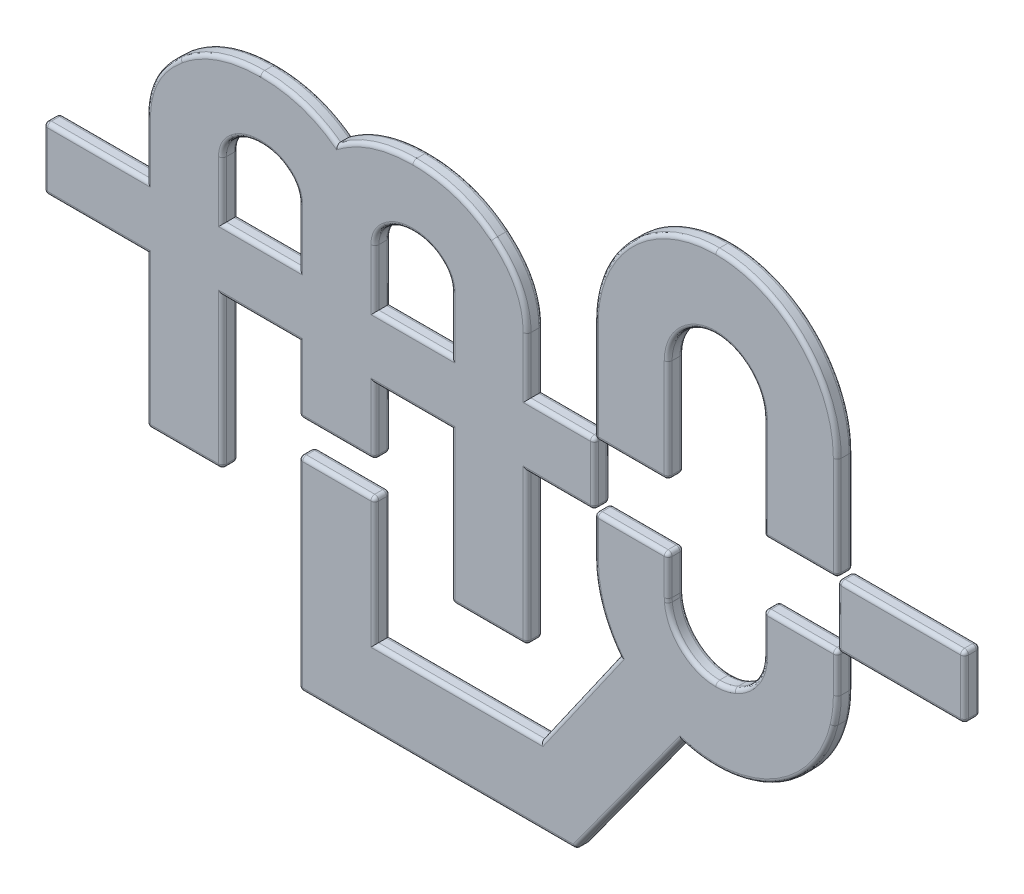
from build123d import *

# Parameters (mm, degrees)
RESSALTO_EXTRUS_O1_DEPTH   = 1
RESSALTO_EXTRUS_O1_2_DEPTH = 1
RESSALTO_EXTRUS_O1_3_DEPTH = 1
ESBO_O1_W                  = 8.061747269
ESBO_O1_H                  = 3.978059691
RESSALTO_EXTRUS_O1_4_DEPTH = 1
FILETE1_R                  = 0.25
FILETE2_R                  = 0.25
FILETE3_R                  = 0.25
FILETE4_R                  = 0.25


with BuildPart() as part:
    # Esboço1 → Ressalto-extrusão1 (new body)
    with BuildSketch(Plane.XY):
        with BuildLine():
            Line((39.102792411, -22.842920896), (39.102792411, -29.360432264))
            Line((39.102792411, -29.360432264), (43.78038713, -29.360432264))
            Line((43.78038713, -29.360432264), (43.78038713, -22.842920896))
            add(Edge.make_bspline(
                [(43.78038713, -22.842920896), (43.78038713, -21.208943181), (45.163603336, -19.825726975), (48.436875604, -19.825726975), (49.817449502, -21.208943181), (49.817449502, -22.842920896)],
                knots=[4, 4, 4, 4, 5, 5, 6.00321442, 6.00321442, 6.00321442, 6.00321442], degree=3))
            Line((49.817449502, -22.842920896), (49.817449502, -29.360432264))
            Line((49.817449502, -29.360432264), (54.49504422, -29.360432264))
            Line((54.49504422, -29.360432264), (54.49504422, -22.842920896))
            add(Edge.make_bspline(
                [(54.49504422, -22.842920896), (54.49504422, -18.611425165), (51.03439362, -15.145489949), (42.568759851, -15.145489949), (39.102792411, -18.611425165), (39.102792411, -22.842920896)],
                knots=[9, 9, 9, 9, 10, 10, 10.998129021, 10.998129021, 10.998129021, 10.998129021], degree=3))
        make_face()
    extrude(amount=RESSALTO_EXTRUS_O1_DEPTH)

    # Filete2
    filete2_edges = [part.edges().sort_by_distance(p)[0] for p in [
        (54.49504422, -26.10167658, 0),
        (46.799340909, -15.145490141, 0),
        (46.799340909, -15.145490141, 0),
        (39.102792411, -26.10167658, 0),
        (41.44158977, -29.360432264, 0),
        (43.78038713, -26.10167658, 0),
        (46.7990481, -19.825727329, 0),
        (46.7990481, -19.825727329, 0),
        (49.817449502, -26.10167658, 0),
        (52.156246861, -29.360432264, 0),
        (54.49504422, -26.10167658, 1),
        (46.799340909, -15.145490141, 1),
        (39.102792411, -26.10167658, 1),
        (41.44158977, -29.360432264, 1),
        (43.78038713, -26.10167658, 1),
        (46.7990481, -19.825727329, 1),
        (46.7990481, -19.825727329, 1),
        (49.817449502, -26.10167658, 1),
        (52.156246861, -29.360432264, 1),
        (54.49504422, -29.360432264, 0.5),
        (49.817449502, -29.360432264, 0.5),
        (43.78038713, -29.360432264, 0.5),
        (39.102792411, -29.360432264, 0.5),
        (46.799340909, -15.145490141, 1),
    ]]
    fillet(filete2_edges, radius=FILETE2_R)


with BuildPart() as body_2:
    # Esboço1 → Ressalto-extrus_o1 2 (new body)
    with BuildSketch(Plane.XY):
        with BuildLine():
            Line((39.102792411, -33.338491955), (39.102792411, -29.360432264))
            Line((39.102792411, -29.360432264), (34.839621204, -29.360432264))
            Line((34.839621204, -29.360432264), (34.839621204, -25.767762916))
            add(Edge.make_bspline(
                [(34.839621204, -25.767762916), (34.839621204, -24.123215968), (34.134833782, -22.724145912), (32.722552184, -21.565300354)],
                knots=[22, 22, 22, 22, 23, 23, 23, 23], degree=3))
            add(Edge.make_bspline(
                [(32.722552184, -21.565300354), (31.312945118, -20.406454797), (29.605014993, -19.825726975), (25.751047126, -19.825726975), (24.14078574, -20.332534609), (22.776065693, -21.343572015)],
                knots=[0, 0, 0, 0, 1, 1, 1.926144233, 1.926144233, 1.926144233, 1.926144233], degree=3))
            add(Edge.make_bspline(
                [(22.776065693, -21.343572015), (21.424492741, -20.332534609), (19.819580418, -19.825726975), (15.965548105, -19.825726975), (14.255007894, -20.409097105), (12.837473903, -21.57322728)],
                knots=[2, 2, 2, 2, 3, 3, 4.079780204, 4.079780204, 4.079780204, 4.079780204], degree=3))
            add(Edge.make_bspline(
                [(12.837473903, -21.57322728), (11.433151453, -22.726788221), (10.730941894, -24.123215968), (10.730941894, -25.767762916)],
                knots=[4, 4, 4, 4, 5, 5, 5, 5], degree=3))
            Line((10.730941894, -25.767762916), (10.730941894, -29.360432264))
            Line((10.730941894, -29.360432264), (4.21082044, -29.360432264))
            Line((4.21082044, -29.360432264), (4.21082044, -33.338491955))
            Line((4.21082044, -33.338491955), (10.730941894, -33.338491955))
            Line((10.730941894, -33.338491955), (10.730941894, -42.873197244))
            Line((10.730941894, -42.873197244), (15.540555361, -42.873197244))
            Line((15.540555361, -42.873197244), (15.540555361, -33.338491955))
            Line((15.540555361, -33.338491955), (20.370616286, -33.338927447))
            Line((20.370616286, -33.338927447), (20.371242848, -37.527742975))
            Line((20.371242848, -37.527742975), (25.19932025, -37.527742975))
            Line((25.19932025, -37.527742975), (25.200193332, -33.338927447))
            Line((25.200193332, -33.338927447), (30.03003996, -33.338491955))
            Line((30.03003996, -33.338491955), (30.03003996, -42.873197244))
            Line((30.03003996, -42.873197244), (34.839621204, -42.873197244))
            Line((34.839621204, -42.873197244), (34.839621204, -33.338491955))
            Line((34.839621204, -33.338491955), (39.102792411, -33.338491955))
        make_face()
        with BuildLine():
            Line((20.371242848, -25.767762916), (20.370616286, -29.361469958))
            Line((20.370616286, -29.361469958), (15.540555361, -29.360432264))
            Line((15.540555361, -29.360432264), (15.540555361, -25.767762916))
            add(Edge.make_bspline(
                [(15.540555361, -25.767762916), (15.540555361, -25.221320657), (15.775495242, -24.756725511), (16.245375005, -24.371335168)],
                knots=[8, 8, 8, 8, 9, 9, 9, 9], degree=3))
            add(Edge.make_bspline(
                [(16.245375005, -24.371335168), (16.717897077, -23.985944826), (17.290697973, -23.790607347), (18.629059383, -23.790607347), (19.199217971, -23.983302518), (19.674382351, -24.363408243)],
                knots=[9, 9, 9, 9, 10, 10, 10.980450124, 10.980450124, 10.980450124, 10.980450124], degree=3))
            add(Edge.make_bspline(
                [(19.674382351, -24.363408243), (20.138977498, -24.754083202), (20.371242848, -25.221320657), (20.371242848, -25.767762916)],
                knots=[11, 11, 11, 11, 12, 12, 12, 12], degree=3))
        make_face(mode=Mode.SUBTRACT)
        with BuildLine():
            Line((30.03003996, -29.360432264), (25.200193332, -29.361469958))
            Line((25.200193332, -29.361469958), (25.19932025, -25.767762916))
            add(Edge.make_bspline(
                [(25.19932025, -25.767762916), (25.19932025, -25.221320657), (25.434260131, -24.756725511), (25.906782203, -24.371335168)],
                knots=[15, 15, 15, 15, 16, 16, 16, 16], degree=3))
            add(Edge.make_bspline(
                [(25.906782203, -24.371335168), (26.376629743, -23.985944826), (26.941568161, -23.790607347), (28.279897348, -23.790607347), (28.850088159, -23.983302518), (29.314683305, -24.363408243)],
                knots=[16, 16, 16, 16, 17, 17, 18.019891061, 18.019891061, 18.019891061, 18.019891061], degree=3))
            add(Edge.make_bspline(
                [(29.314683305, -24.363408243), (29.79245777, -24.754083202), (30.03003996, -25.221320657), (30.03003996, -25.767762916)],
                knots=[18, 18, 18, 18, 19, 19, 19, 19], degree=3))
            Line((30.03003996, -25.767762916), (30.03003996, -29.360432264))
        make_face(mode=Mode.SUBTRACT)
    extrude(amount=RESSALTO_EXTRUS_O1_2_DEPTH)

    # Filete1
    filete1_edges = [body_2.edges().sort_by_distance(p)[0] for p in [
        (15.727817735, -24.987648089, 0),
        (17.95824139, -23.790617046, 0),
        (17.95824139, -23.790617046, 0),
        (20.186268852, -24.985863664, 0),
        (20.370929567, -27.564616437, 0),
        (17.955585823, -29.360951111, 0),
        (15.540555361, -27.56409759, 0),
        (25.387268762, -24.987030603, 0),
        (27.609078559, -23.790610776, 0),
        (27.609078559, -23.790610776, 0),
        (29.838702371, -24.982495141, 0),
        (30.03003996, -27.56409759, 0),
        (27.615116646, -29.360951111, 0),
        (25.199756791, -27.564616437, 0),
        (17.767887254, -19.827661091, 0),
        (11.288604185, -23.425672149, 0),
        (10.730941894, -27.56409759, 0),
        (7.470881167, -29.360432264, 0),
        (4.21082044, -31.34946211, 0),
        (7.470881167, -33.338491955, 0),
        (10.730941894, -38.105844599, 0),
        (13.135748627, -42.873197244, 0),
        (15.540555361, -38.105844599, 0),
        (17.955585823, -33.338709701, 0),
        (20.370929567, -35.433335211, 0),
        (22.785281549, -37.527742975, 0),
        (25.199756791, -35.433335211, 0),
        (27.615116646, -33.338709701, 0),
        (30.03003996, -38.105844599, 0),
        (32.434830582, -42.873197244, 0),
        (34.839621204, -38.105844599, 0),
        (36.971206808, -33.338491955, 0),
        (39.102792411, -31.34946211, 0),
        (36.971206808, -29.360432264, 0),
        (34.839621204, -27.56409759, 0),
        (34.277925454, -23.42049707, 0),
        (27.788041731, -19.827376934, 0),
        (27.788041731, -19.827376934, 0),
        (17.767887254, -19.827661091, 0),
        (15.727817735, -24.987648089, 1),
        (17.95824139, -23.790617046, 1),
        (17.95824139, -23.790617046, 1),
        (20.186268852, -24.985863664, 1),
        (20.370929567, -27.564616437, 1),
        (17.955585823, -29.360951111, 1),
        (15.540555361, -27.56409759, 1),
        (25.387268762, -24.987030603, 1),
        (27.609078559, -23.790610776, 1),
        (27.609078559, -23.790610776, 1),
        (29.838702371, -24.982495141, 1),
        (30.03003996, -27.56409759, 1),
        (27.615116646, -29.360951111, 1),
        (25.199756791, -27.564616437, 1),
        (17.767887254, -19.827661091, 1),
        (10.730941894, -27.56409759, 1),
        (7.470881167, -29.360432264, 1),
        (4.21082044, -31.34946211, 1),
        (7.470881167, -33.338491955, 1),
        (10.730941894, -38.105844599, 1),
        (13.135748627, -42.873197244, 1),
        (15.540555361, -38.105844599, 1),
        (17.955585823, -33.338709701, 1),
        (20.370929567, -35.433335211, 1),
        (22.785281549, -37.527742975, 1),
        (25.199756791, -35.433335211, 1),
        (27.615116646, -33.338709701, 1),
        (30.03003996, -38.105844599, 1),
        (32.434830582, -42.873197244, 1),
        (34.839621204, -38.105844599, 1),
        (36.971206808, -33.338491955, 1),
        (39.102792411, -31.34946211, 1),
        (36.971206808, -29.360432264, 1),
        (34.839621204, -27.56409759, 1),
        (34.277925454, -23.42049707, 1),
        (27.788041731, -19.827376934, 1),
        (27.788041731, -19.827376934, 1),
        (17.767887254, -19.827661091, 1),
        (25.906782203, -24.371335168, 0.5),
        (39.102792411, -29.360432264, 0.5),
        (39.102792411, -33.338491955, 0.5),
        (34.839621204, -42.873197244, 0.5),
        (30.03003996, -42.873197244, 0.5),
        (25.19932025, -37.527742975, 0.5),
        (20.371242848, -37.527742975, 0.5),
        (15.540555361, -42.873197244, 0.5),
        (10.730941894, -42.873197244, 0.5),
        (4.21082044, -33.338491955, 0.5),
        (4.21082044, -29.360432264, 0.5),
        (11.288604185, -23.425672149, 1),
    ]]
    fillet(filete1_edges, radius=FILETE1_R)


with BuildPart() as body_3:
    # Esboço1 → Ressalto-extrus_o1 3 (new body)
    with BuildSketch(Plane.XY):
        with BuildLine():
            Line((43.78038713, -33.338491955), (39.102792411, -33.338491955))
            Line((39.102792411, -33.338491955), (39.102792411, -35.840951316))
            add(Edge.make_bspline(
                [(39.102792411, -35.840951316), (39.102792411, -37.588483844), (39.694089466, -39.211892325), (40.689273022, -40.508009024)],
                knots=[8, 8, 8, 8, 9, 9, 9, 9], degree=3))
            Line((40.689273022, -40.508009024), (35.716029776, -47.61417514))
            Line((35.716029776, -47.61417514), (25.188751016, -47.61417514))
            Line((25.188751016, -47.61417514), (25.188751016, -39.594640358))
            Line((25.188751016, -39.594640358), (20.371242848, -39.594640358))
            Line((20.371242848, -39.594640358), (20.371242848, -52.500318879))
            Line((20.371242848, -52.500318879), (37.893807441, -52.502961188))
            Line((37.893807441, -52.502961188), (44.622477916, -43.221627492))
            add(Edge.make_bspline(
                [(44.622477916, -43.221627492), (45.314053796, -43.427534205), (46.042621993, -43.538414486), (50.432527332, -43.538414486), (53.499860665, -40.988425798), (54.291779816, -37.585841535)],
                knots=[10, 10, 10, 10, 11, 11, 15.81451131, 15.81451131, 15.81451131, 15.81451131], degree=3))
            add(Edge.make_bspline(
                [(54.291779816, -37.585841535), (54.426408649, -37.023545426), (54.49504422, -36.440175296), (54.49504422, -35.840951316)],
                knots=[12, 12, 12, 12, 13, 13, 13, 13], degree=3))
            Line((54.49504422, -35.840951316), (54.49504422, -33.338491955))
            Line((54.49504422, -33.338491955), (49.817449502, -33.338491955))
            Line((49.817449502, -33.338491955), (49.817449502, -35.840951316))
            add(Edge.make_bspline(
                [(49.242006297, -37.585841535), (49.603615864, -37.092180997), (49.817449502, -36.487704623), (49.817449502, -35.840951316)],
                knots=[0, 0, 0, 0, 1, 1, 1, 1], degree=3))
            add(Edge.make_bspline(
                [(47.964353533, -38.615310653), (48.476478007, -38.396224622), (48.917324601, -38.034582832), (49.242006297, -37.585841535)],
                knots=[1, 1, 1, 1, 2, 2, 2, 2], degree=3))
            add(Edge.make_bspline(
                [(47.964353533, -38.615310653), (47.605354051, -38.773720262), (47.209394476, -38.860819768), (45.240165832, -38.860819768), (43.915015963, -37.609590087), (43.790956363, -36.075891198)],
                knots=[2, 2, 2, 2, 3, 3, 6.782220831, 6.782220831, 6.782220831, 6.782220831], degree=3))
            add(Edge.make_bspline(
                [(43.78038713, -35.840951316), (43.78038713, -35.917513812), (43.783029438, -35.999360925), (43.790956363, -36.075891198)],
                knots=[4, 4, 4, 4, 5, 5, 5, 5], degree=3))
            Line((43.78038713, -35.840951316), (43.78038713, -33.338491955))
        make_face()
    extrude(amount=RESSALTO_EXTRUS_O1_3_DEPTH)

    # Filete4
    filete4_edges = [body_3.edges().sort_by_distance(p)[0] for p in [
        (39.102792411, -34.589721635, 0),
        (39.509780744, -38.305719132, 0),
        (38.202651399, -44.061092082, 0),
        (30.452390396, -47.61417514, 0),
        (25.188751016, -43.604407749, 0),
        (22.779996932, -39.594640358, 0),
        (20.371242848, -46.047479619, 0),
        (29.132525144, -52.501640033, 0),
        (41.258142679, -47.86229434, 0),
        (50.669413402, -42.487749107, 0),
        (50.669413402, -42.487749107, 0),
        (54.44480927, -36.719403815, 0),
        (54.49504422, -34.589721635, 0),
        (52.156246861, -33.338491955, 0),
        (49.817449502, -34.589721635, 0),
        (49.669177826, -36.759278337, 0),
        (48.672839124, -38.187208144, 0),
        (45.236192412, -38.410349874, 0),
        (45.236192412, -38.410349874, 0),
        (43.782704422, -35.958559696, 0),
        (43.78038713, -34.589721635, 0),
        (41.44158977, -33.338491955, 0),
        (39.102792411, -34.589721635, 1),
        (39.509780744, -38.305719132, 1),
        (38.202651399, -44.061092082, 1),
        (30.452390396, -47.61417514, 1),
        (25.188751016, -43.604407749, 1),
        (22.779996932, -39.594640358, 1),
        (20.371242848, -46.047479619, 1),
        (29.132525144, -52.501640033, 1),
        (41.258142679, -47.86229434, 1),
        (50.669413402, -42.487749107, 1),
        (50.669413402, -42.487749107, 1),
        (54.44480927, -36.719403815, 1),
        (54.49504422, -34.589721635, 1),
        (49.817449502, -34.589721635, 1),
        (49.669177826, -36.759278337, 1),
        (48.672839124, -38.187208144, 1),
        (45.236192412, -38.410349874, 1),
        (45.236192412, -38.410349874, 1),
        (43.782704422, -35.958559696, 1),
        (43.78038713, -34.589721635, 1),
        (41.44158977, -33.338491955, 1),
        (39.102792411, -33.338491955, 0.5),
        (43.78038713, -33.338491955, 0.5),
        (43.790956363, -36.075891198, 0.5),
        (47.964353533, -38.615310653, 0.5),
        (49.242006297, -37.585841535, 0.5),
        (49.817449502, -33.338491955, 0.5),
        (54.49504422, -33.338491955, 0.5),
        (37.893807441, -52.502961188, 0.5),
        (20.371242848, -52.500318879, 0.5),
        (20.371242848, -39.594640358, 0.5),
        (25.188751016, -39.594640358, 0.5),
        (52.156246861, -33.338491955, 1),
    ]]
    fillet(filete4_edges, radius=FILETE4_R)


with BuildPart() as body_4:
    # Esboço1 → Ressalto-extrus_o1 4 (new body)
    with BuildSketch(Plane.XY):
        with Locations((58.525917855, -31.34946211)):
            Rectangle(ESBO_O1_W, ESBO_O1_H)
    extrude(amount=RESSALTO_EXTRUS_O1_4_DEPTH)

    # Filete3
    filete3_edges = [body_4.edges().sort_by_distance(p)[0] for p in [
        (54.49504422, -31.34946211, 0),
        (58.525917855, -33.338491955, 0),
        (62.556791489, -31.34946211, 0),
        (58.525917855, -29.360432264, 0),
        (58.525917855, -33.338491955, 1),
        (62.556791489, -31.34946211, 1),
        (58.525917855, -29.360432264, 1),
        (54.49504422, -29.360432264, 0.5),
        (62.556791489, -29.360432264, 0.5),
        (62.556791489, -33.338491955, 0.5),
        (54.49504422, -33.338491955, 0.5),
        (54.49504422, -31.34946211, 1),
    ]]
    fillet(filete3_edges, radius=FILETE3_R)


solid = Compound([part.part, body_2.part, body_3.part, body_4.part])
